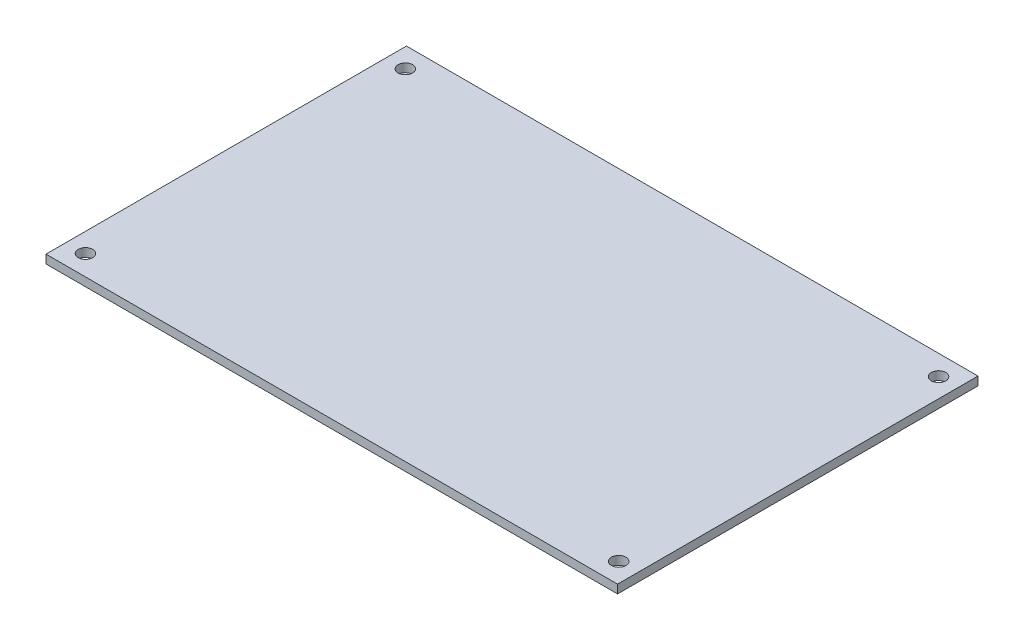
from build123d import *

# Parameters (mm, degrees)
SKETCH1_W                = 134
SKETCH1_H                = 84.5
BOSS_EXTRUDE1_DEPTH      = 2
M3_CLEARANCE_HOLE1_D     = 3.4
M3_CLEARANCE_HOLE1_DEPTH = 5
M3_CLEARANCE_HOLE1_TIP   = 1.021463052


with BuildPart() as part:
    # Sketch1 → Boss-Extrude1 (new body)
    with BuildSketch(Plane(origin=(0, 0, 0), x_dir=(1, 0, 0), z_dir=(0, 1, 0))):
        with Locations((67, 42.25)):
            Rectangle(SKETCH1_W, SKETCH1_H)
    extrude(amount=BOSS_EXTRUDE1_DEPTH)

    # M3 Clearance Hole1
    with Locations(Plane(origin=(0, 2, 0), x_dir=(1, 0, 0), z_dir=(0, 1, 0))):
        with Locations((4.5, 79.75), (129.5, 79.75), (129.5, 4.75), (4.5, 4.75)):
            Hole(M3_CLEARANCE_HOLE1_D / 2, depth=M3_CLEARANCE_HOLE1_DEPTH)
            with Locations((0, 0, -(M3_CLEARANCE_HOLE1_DEPTH + M3_CLEARANCE_HOLE1_TIP / 2))):  # 118° drill point
                Cone(0, M3_CLEARANCE_HOLE1_D / 2, M3_CLEARANCE_HOLE1_TIP, mode=Mode.SUBTRACT)


solid = part.part
